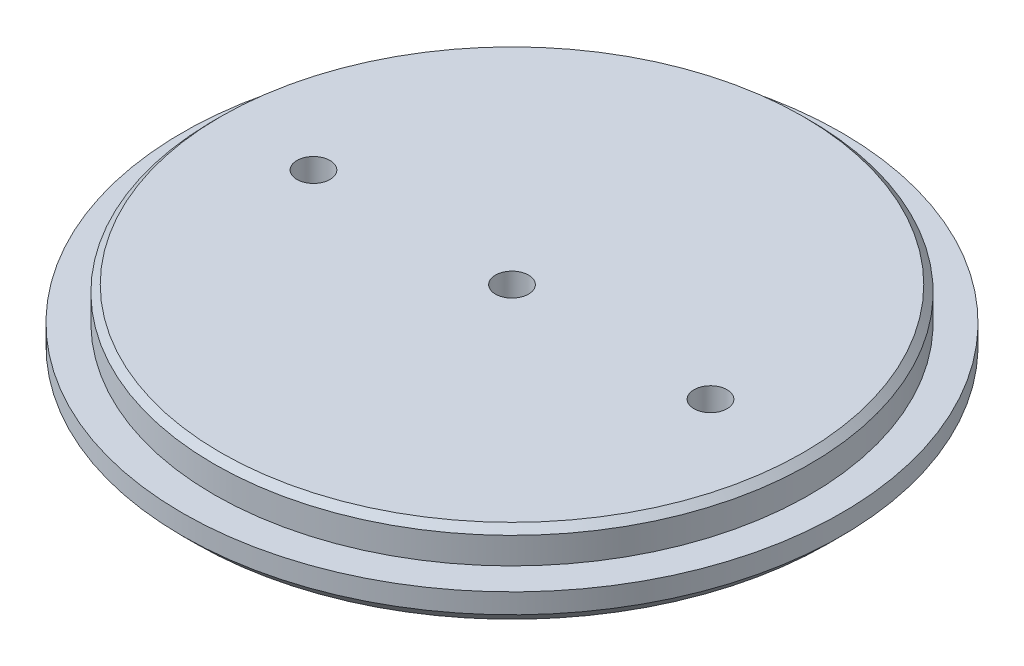
from build123d import *

# Parameters (mm, degrees)
SKETCH1_R           = 63.246
BOSS_EXTRUDE1_DEPTH = 6.35
SKETCH2_R           = 57.15
BOSS_EXTRUDE2_DEPTH = 6.35
CHAMFER1_SIZE       = 1.27
SKETCH4_R           = 3.175
CUT_EXTRUDE1_DEPTH  = 91.340483904
CHAMFER2_SIZE       = 2.54


with BuildPart() as part:
    # Sketch1 → Boss-Extrude1 (new body)
    with BuildSketch(Plane(origin=(0, 0, 0), x_dir=(1, 0, 0), z_dir=(0, 1, 0))):
        Circle(SKETCH1_R)
    extrude(amount=BOSS_EXTRUDE1_DEPTH)

    # Sketch2 → Boss-Extrude2 (add)
    with BuildSketch(Plane(origin=(0, 6.35, 0), x_dir=(1, 0, 0), z_dir=(0, 1, 0))):
        Circle(SKETCH2_R)
    extrude(amount=BOSS_EXTRUDE2_DEPTH)

    # Chamfer1
    chamfer1_edges = [part.edges().sort_by_distance(p)[0] for p in [
        (-57.15, 12.7, 0),
    ]]
    chamfer(chamfer1_edges, length=CHAMFER1_SIZE)

    # Sketch4 → Cut-Extrude1 (cut, through all)
    with BuildSketch(Plane.XZ):
        with Locations((-38.1, 0)):
            Circle(SKETCH4_R)
        Circle(SKETCH4_R)
        with Locations((38.1, 0)):
            Circle(SKETCH4_R)
    extrude(amount=-CUT_EXTRUDE1_DEPTH, mode=Mode.SUBTRACT)

    # Chamfer2
    chamfer2_edges = [part.edges().sort_by_distance(p)[0] for p in [
        (-63.246, 0, 0),
    ]]
    chamfer(chamfer2_edges, length=CHAMFER2_SIZE)


solid = part.part
